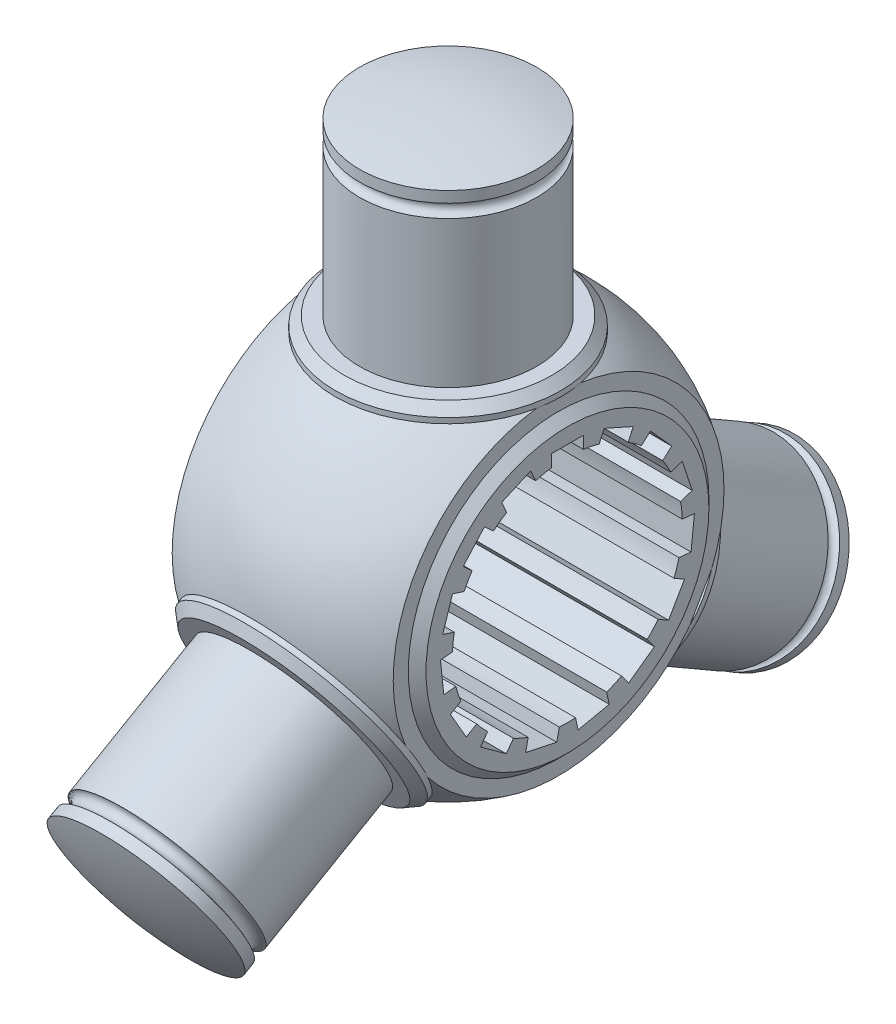
from build123d import *

# Parameters (mm, degrees)
BOSS_EXTRUDE1_START          = 1
SKETCH3_R                    = 17
SKETCH3_R_2                  = 13
BOSS_EXTRUDE1_DEPTH          = 1
CHAMFER1_SIZE                = 1
CHAMFER2_SIZE                = 1
SKETCH8_R                    = 0.75
CIRPATTERN2_COUNT            = 3
CHAMFER2_OF_CIRPATTERN2_SIZE = 1
SKETCH9_W                    = 3.6
SKETCH9_H                    = 2
CUT_EXTRUDE1_DEPTH           = 63.299818922
CIRPATTERN3_COUNT            = 15


with BuildPart() as part:
    # Sketch1 → Revolve1 (revolve)
    with BuildSketch(Plane.XY, mode=Mode.PRIVATE) as revolve1_sk:
        with BuildLine():
            Line((12.5, 13), (12.5, 18.708286934))
            ThreePointArc((12.5, 18.708286934), (0, 22.5), (-12.5, 18.708286934))
            Line((-12.5, 18.708286934), (-12.5, 13))
            Line((-12.5, 13), (12.5, 13))
        make_face()
    revolve(revolve1_sk.sketch.rotate(Axis((0, 0, 0), (1, 0, 0)), 90), axis=Axis((0, 0, 0), (1, 0, 0)))

    # Sketch3 → Boss-Extrude1 (add)
    with BuildSketch(Plane(origin=(12.5, 0, 0), x_dir=(0, 0, -1), z_dir=(1, 0, 0)).offset(BOSS_EXTRUDE1_START)):
        Circle(SKETCH3_R)
        with Locations(Location((0, 0, 0), (0, 0, 180))):
            Circle(SKETCH3_R_2, mode=Mode.SUBTRACT)
    extrude(amount=-BOSS_EXTRUDE1_DEPTH)

    # Chamfer1
    chamfer1_edges = [part.edges().sort_by_distance(p)[0] for p in [
        (13.5, 0, 17),
    ]]
    chamfer(chamfer1_edges, length=CHAMFER1_SIZE - 0.0001)  # a hair under: the kernel refuses the full size

    # Sketch7 → Revolve2 (revolve)
    with BuildSketch(Plane(origin=(0, 0, 0), x_dir=(0, 0, -1), z_dir=(1, 0, 0))):
        with BuildLine():
            Line((0, 18.708286934), (0, 40.708286934))
            ThreePointArc((0, 40.708286934), (5.048567788, 40.394030067), (10.019191725, 39.456111217))
            Line((10.019191725, 39.456111217), (10.019191725, 20.146111217))
            Line((10.019191725, 20.146111217), (12.75, 20.146111217))
            Line((12.75, 20.146111217), (12.75, 18.538810641))
            Line((12.75, 18.538810641), (0, 18.708286934))
        make_face()
    revolve2 = revolve(axis=Axis((0, 18.708286934, 0), (0, 1, 0)))

    # Chamfer2
    chamfer2_edges = [part.edges().sort_by_distance(p)[0] for p in [
        (0, 20.146111217, 12.75),
    ]]
    chamfer(chamfer2_edges, length=CHAMFER2_SIZE)

    # Sketch8 → Cut-Revolve1 (revolve, cut)
    with BuildSketch(Plane(origin=(0, 0, 0), x_dir=(0, 0, -1), z_dir=(1, 0, 0))):
        with Locations((10.019191725, 37.456111217)):
            Circle(SKETCH8_R)
    cut_revolve1 = revolve(axis=Axis((0, 20.146111217, 0), (0, 1, 0)), mode=Mode.SUBTRACT)

    # CirPattern2: Revolve2, Cut-Revolve1 ×3 about axis
    cirpattern2_axis = Axis((0, 0, 0), (1, 0, 0))
    add([revolve2.rotate(cirpattern2_axis, i * 360 / CIRPATTERN2_COUNT) for i in range(1, CIRPATTERN2_COUNT)])
    add([cut_revolve1.rotate(cirpattern2_axis, i * 360 / CIRPATTERN2_COUNT) for i in range(1, CIRPATTERN2_COUNT)], mode=Mode.SUBTRACT)

    # Chamfer2 of CirPattern2
    chamfer2_of_cirpattern2_edges = [part.edges().sort_by_distance(p)[0] for p in [
        (0, -21.114879507, 11.072044102),
        (0, 0.96876829, -23.822044102),
    ]]
    chamfer(chamfer2_of_cirpattern2_edges, length=CHAMFER2_OF_CIRPATTERN2_SIZE)

    # Sketch9 → Cut-Extrude1 (cut, through all)
    with BuildSketch(Plane(origin=(13.5, 0, 0), x_dir=(0, 0, -1), z_dir=(1, 0, 0))):
        with Locations((0, 13.25)):
            Rectangle(SKETCH9_W, SKETCH9_H)
    cut_extrude1 = extrude(amount=-CUT_EXTRUDE1_DEPTH, mode=Mode.SUBTRACT)

    # CirPattern3: Cut-Extrude1 ×15 about axis
    cirpattern3_axis = Axis((0, 0, 0), (1, 0, 0))
    for i in range(1, CIRPATTERN3_COUNT):
        add(cut_extrude1.rotate(cirpattern3_axis, i * 360 / CIRPATTERN3_COUNT), mode=Mode.SUBTRACT)


solid = part.part
